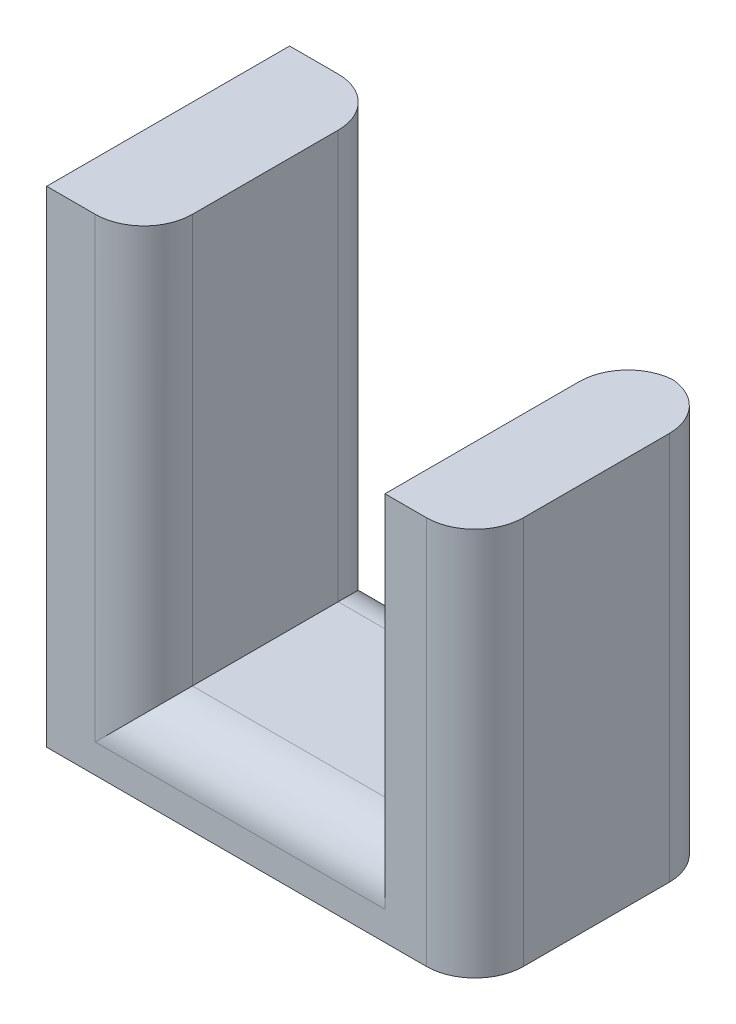
from build123d import *

# Parameters (mm, degrees)
EXTRUDE_1_DEPTH     = 25
SKETCH_2_R          = 9.75
CUT_EXTRUDE_1_DEPTH = 5
FILLET_2_R          = 5


with BuildPart() as part:
    # 草圖1 → 填料-伸長1 (new body)
    with BuildSketch(Plane.XY):
        Polygon((12.962962963, -21.018518519), (47.037037037, -21.018518519), (47.037037037, 18.981481481), (37.777777778, 18.981481481), (37.777777778, -13.055555556), (12.962962963, -13.055555556), (12.962962963, 28.981481481), (2.962962963, 28.981481481), (2.962962963, -21.018518519), align=None)
    extrude(amount=EXTRUDE_1_DEPTH)

    # 草圖2 → 除料-伸長1 (cut)
    with BuildSketch(Plane.ZY.offset(-2.962962963)):
        with Locations(Location((12.5, 17.139708428, 0), (0, 0, 270))):
            Circle(SKETCH_2_R)
    extrude(amount=-CUT_EXTRUDE_1_DEPTH, mode=Mode.SUBTRACT)

    # 圓角2
    # the kernel refuses this fillet: 5 mm, written as the material it takes off along each edge
    with BuildSketch(Plane(origin=(47.037037037, -33.518518519, 25), x_dir=(0, 0, -1), z_dir=(0, 1, 0))) as fillet_2_piece_1:
        with BuildLine():
            CenterArc((FILLET_2_R, FILLET_2_R), FILLET_2_R, 180, 90)
            Line((0, FILLET_2_R), (0, 0))
            Line((0, 0), (FILLET_2_R, 0))
        make_face()
    extrude(amount=65, mode=Mode.SUBTRACT)
    with BuildSketch(Plane(origin=(47.037037037, -33.518518519, 0), x_dir=(0, 0, 1), z_dir=(0, 1, 0))) as fillet_2_piece_2:
        with BuildLine():
            CenterArc((FILLET_2_R, -FILLET_2_R), FILLET_2_R, 90, 90)
            Line((0, -FILLET_2_R), (0, 0))
            Line((0, 0), (FILLET_2_R, 0))
        make_face()
    extrude(amount=65, mode=Mode.SUBTRACT)
    with BuildSketch(Plane(origin=(37.777777778, 31.481481481, 0), x_dir=(1, 0, 0), z_dir=(0, -1, 0))) as fillet_2_piece_3:
        with BuildLine():
            CenterArc((FILLET_2_R, FILLET_2_R), FILLET_2_R, 180, 90)
            Line((0, FILLET_2_R), (0, 0))
            Line((0, 0), (FILLET_2_R, 0))
        make_face()
    extrude(amount=44.537037037, mode=Mode.SUBTRACT)
    with BuildSketch(Plane(origin=(12.962962963, -13.055555556, 25), x_dir=(-1, 0, 0), z_dir=(0, 1, 0))) as fillet_2_piece_4:
        with BuildLine():
            CenterArc((FILLET_2_R, -FILLET_2_R), FILLET_2_R, 90, 90)
            Line((0, -FILLET_2_R), (0, 0))
            Line((0, 0), (FILLET_2_R, 0))
        make_face()
    extrude(amount=54.537037037, mode=Mode.SUBTRACT)
    with BuildSketch(Plane(origin=(12.962962963, -13.055555556, 0), x_dir=(-1, 0, 0), z_dir=(0, 1, 0))) as fillet_2_piece_5:
        with BuildLine():
            CenterArc((FILLET_2_R, FILLET_2_R), FILLET_2_R, 180, 90)
            Line((0, FILLET_2_R), (0, 0))
            Line((0, 0), (FILLET_2_R, 0))
        make_face()
    extrude(amount=54.537037037, mode=Mode.SUBTRACT)
    with BuildSketch(Plane(origin=(37.777777778, -13.055555556, 25), x_dir=(0, -1, 0), z_dir=(-1, 0, 0))) as fillet_2_piece_6:
        with BuildLine():
            CenterArc((FILLET_2_R, -FILLET_2_R), FILLET_2_R, 90, 90)
            Line((0, -FILLET_2_R), (0, 0))
            Line((0, 0), (FILLET_2_R, 0))
        make_face()
    extrude(amount=24.814814815, mode=Mode.SUBTRACT)
    with BuildSketch(Plane(origin=(37.777777778, -13.055555556, 0), x_dir=(0, -1, 0), z_dir=(-1, 0, 0))) as fillet_2_piece_7:
        with BuildLine():
            CenterArc((FILLET_2_R, FILLET_2_R), FILLET_2_R, 180, 90)
            Line((0, FILLET_2_R), (0, 0))
            Line((0, 0), (FILLET_2_R, 0))
        make_face()
    extrude(amount=24.814814815, mode=Mode.SUBTRACT)
    with BuildSketch(Plane(origin=(37.777777778, 31.481481481, 0), x_dir=(1, 0, 0), z_dir=(0, -1, 0))) as fillet_2_piece_8a_section:
        with BuildLine():
            CenterArc((FILLET_2_R, FILLET_2_R), FILLET_2_R, 180, 90)
            Line((0, FILLET_2_R), (0, 0))
            Line((0, 0), (FILLET_2_R, 0))
        make_face()
    fillet_2_piece_8a = extrude(amount=57.037037037, mode=Mode.PRIVATE)
    fillet_2_piece_8a = split(fillet_2_piece_8a, bisect_by=Plane(origin=(38.909753349, -13.055555556, 1.131975571), z_dir=(0, -1, 0)), keep=Keep.TOP, mode=Mode.PRIVATE)
    with BuildSketch(Plane(origin=(50.277777778, -13.055555556, 0), x_dir=(0, -1, 0), z_dir=(-1, 0, 0))) as fillet_2_piece_8b_section:
        with BuildLine():
            CenterArc((FILLET_2_R, FILLET_2_R), FILLET_2_R, 180, 90)
            Line((0, FILLET_2_R), (0, 0))
            Line((0, 0), (FILLET_2_R, 0))
        make_face()
    fillet_2_piece_8b = extrude(amount=37.314814815, mode=Mode.PRIVATE)
    fillet_2_piece_8b = split(fillet_2_piece_8b, bisect_by=Plane(origin=(37.777777778, -14.187531127, 1.131975571), z_dir=(1, 0, 0)), keep=Keep.TOP, mode=Mode.PRIVATE)
    fillet_2_piece_8 = fillet_2_piece_8a & fillet_2_piece_8b
    add(fillet_2_piece_8, mode=Mode.SUBTRACT)
    with BuildSketch(Plane(origin=(37.777777778, -13.055555556, 25), x_dir=(0, -1, 0), z_dir=(-1, 0, 0))) as fillet_2_piece_9a_section:
        with BuildLine():
            CenterArc((FILLET_2_R, -FILLET_2_R), FILLET_2_R, 90, 90)
            Line((0, -FILLET_2_R), (0, 0))
            Line((0, 0), (FILLET_2_R, 0))
        make_face()
    fillet_2_piece_9a = extrude(amount=37.314814815, mode=Mode.PRIVATE)
    fillet_2_piece_9a = split(fillet_2_piece_9a, bisect_by=Plane(origin=(12.962962963, -14.187531127, 23.868024429), z_dir=(-1, 0, 0)), keep=Keep.TOP, mode=Mode.PRIVATE)
    with BuildSketch(Plane(origin=(12.962962963, -25.555555556, 25), x_dir=(-1, 0, 0), z_dir=(0, 1, 0))) as fillet_2_piece_9b_section:
        with BuildLine():
            CenterArc((FILLET_2_R, -FILLET_2_R), FILLET_2_R, 90, 90)
            Line((0, -FILLET_2_R), (0, 0))
            Line((0, 0), (FILLET_2_R, 0))
        make_face()
    fillet_2_piece_9b = extrude(amount=67.037037037, mode=Mode.PRIVATE)
    fillet_2_piece_9b = split(fillet_2_piece_9b, bisect_by=Plane(origin=(11.830987392, -13.055555556, 23.868024429), z_dir=(0, -1, 0)), keep=Keep.TOP, mode=Mode.PRIVATE)
    fillet_2_piece_9 = fillet_2_piece_9a & fillet_2_piece_9b
    add(fillet_2_piece_9, mode=Mode.SUBTRACT)
    with BuildSketch(Plane(origin=(37.777777778, -13.055555556, 0), x_dir=(0, -1, 0), z_dir=(-1, 0, 0))) as fillet_2_piece_10a_section:
        with BuildLine():
            CenterArc((FILLET_2_R, FILLET_2_R), FILLET_2_R, 180, 90)
            Line((0, FILLET_2_R), (0, 0))
            Line((0, 0), (FILLET_2_R, 0))
        make_face()
    fillet_2_piece_10a = extrude(amount=37.314814815, mode=Mode.PRIVATE)
    fillet_2_piece_10a = split(fillet_2_piece_10a, bisect_by=Plane(origin=(12.962962963, -14.187531127, 1.131975571), z_dir=(-1, 0, 0)), keep=Keep.TOP, mode=Mode.PRIVATE)
    with BuildSketch(Plane(origin=(12.962962963, -25.555555556, 0), x_dir=(-1, 0, 0), z_dir=(0, 1, 0))) as fillet_2_piece_10b_section:
        with BuildLine():
            CenterArc((FILLET_2_R, FILLET_2_R), FILLET_2_R, 180, 90)
            Line((0, FILLET_2_R), (0, 0))
            Line((0, 0), (FILLET_2_R, 0))
        make_face()
    fillet_2_piece_10b = extrude(amount=67.037037037, mode=Mode.PRIVATE)
    fillet_2_piece_10b = split(fillet_2_piece_10b, bisect_by=Plane(origin=(11.830987392, -13.055555556, 1.131975571), z_dir=(0, -1, 0)), keep=Keep.TOP, mode=Mode.PRIVATE)
    fillet_2_piece_10 = fillet_2_piece_10a & fillet_2_piece_10b
    add(fillet_2_piece_10, mode=Mode.SUBTRACT)


solid = part.part
